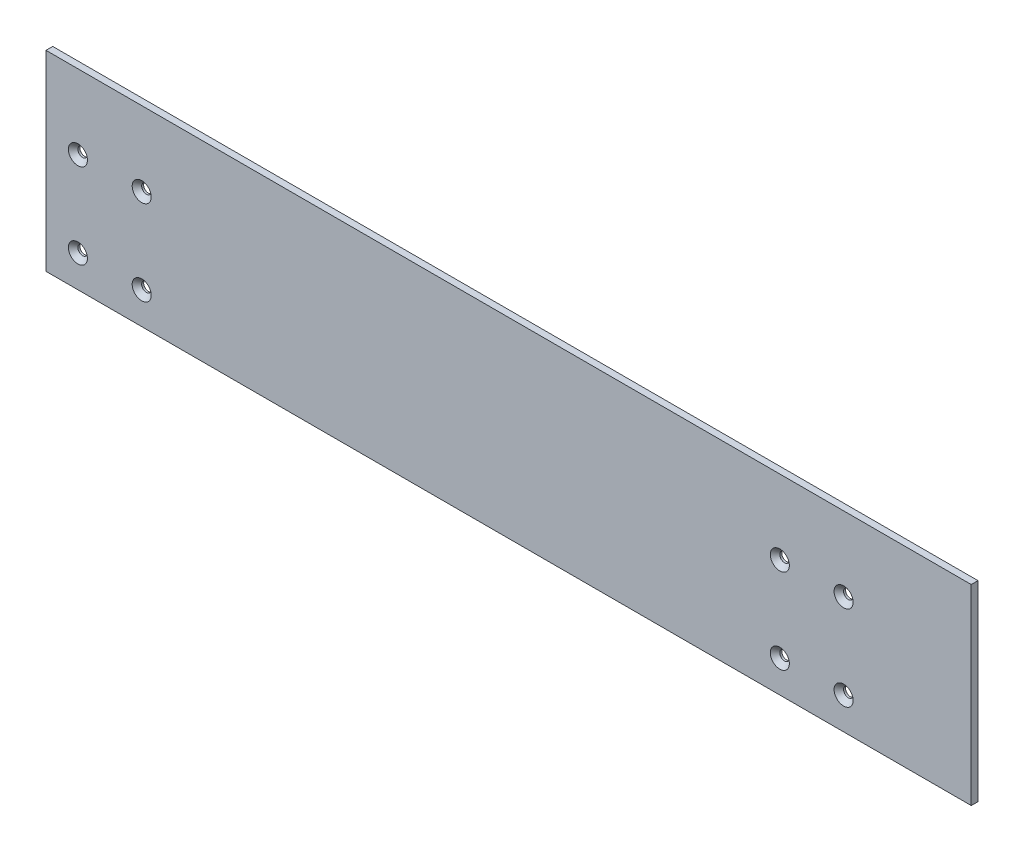
from build123d import *

# Parameters (mm, degrees)
SKETCH2_W                    = 435
SKETCH2_H                    = 90
BOSS_EXTRUDE1_DEPTH          = 3.175
CSK_FOR_M4_SFHCS1_AT_2_COUNT = 2
CSK_FOR_M4_SFHCS1_AT_2_PITCH = 50
CSK_FOR_M4_SFHCS1_AT_3_COUNT = 2
CSK_FOR_M4_SFHCS1_AT_3_PITCH = 30
CSK_FOR_M4_SFHCS1_AT_4_COUNT = 2
CSK_FOR_M4_SFHCS1_AT_4_PITCH = 40
CSK_FOR_M4_SFHCS1_AT_5_COUNT = 2
CSK_FOR_M4_SFHCS1_AT_5_PITCH = 330
CSK_FOR_M4_SFHCS1_AT_6_COUNT = 2
CSK_FOR_M4_SFHCS1_AT_6_PITCH = 302.654919008
CSK_FOR_M4_SFHCS1_AT_7_COUNT = 2
CSK_FOR_M4_SFHCS1_AT_7_PITCH = 300
CSK_FOR_M4_SFHCS1_AT_8_COUNT = 2
CSK_FOR_M4_SFHCS1_AT_8_PITCH = 332.415402772


with BuildPart() as part:
    # Sketch2 → Boss-Extrude1 (new body)
    with BuildSketch(Plane.XY):
        Rectangle(SKETCH2_W, SKETCH2_H)
    extrude(amount=BOSS_EXTRUDE1_DEPTH)

    # Sketch4 → CSK for M4 SFHCS1 (revolve, cut)
    with BuildSketch(Plane(origin=(-172.5, 10, 3.175), x_dir=(0, -1, 0), z_dir=(1, 0, 0))):
        Polygon((0, 0), (0, 3.175), (2.25, 3.175), (2.25, 2.23), (4.48, 0), align=None)
    csk_for_m4_sfhcs1 = revolve(axis=Axis((-172.5, 10, 9.525), (0, 0, -1)), mode=Mode.SUBTRACT)

    # CSK for M4 SFHCS1 at 2: CSK for M4 SFHCS1 ×2
    with Locations(*[Vector(-0.6, -0.8, 0) * (i * CSK_FOR_M4_SFHCS1_AT_2_PITCH) for i in range(1, CSK_FOR_M4_SFHCS1_AT_2_COUNT)]):
        add(csk_for_m4_sfhcs1, mode=Mode.SUBTRACT)

    # CSK for M4 SFHCS1 at 3: CSK for M4 SFHCS1 ×2
    with Locations(*[(-i * CSK_FOR_M4_SFHCS1_AT_3_PITCH, 0, 0) for i in range(1, CSK_FOR_M4_SFHCS1_AT_3_COUNT)]):
        add(csk_for_m4_sfhcs1, mode=Mode.SUBTRACT)

    # CSK for M4 SFHCS1 at 4: CSK for M4 SFHCS1 ×2
    with Locations(*[(0, -i * CSK_FOR_M4_SFHCS1_AT_4_PITCH, 0) for i in range(1, CSK_FOR_M4_SFHCS1_AT_4_COUNT)]):
        add(csk_for_m4_sfhcs1, mode=Mode.SUBTRACT)

    # CSK for M4 SFHCS1 at 5: CSK for M4 SFHCS1 ×2
    with Locations(*[(i * CSK_FOR_M4_SFHCS1_AT_5_PITCH, 0, 0) for i in range(1, CSK_FOR_M4_SFHCS1_AT_5_COUNT)]):
        add(csk_for_m4_sfhcs1, mode=Mode.SUBTRACT)

    # CSK for M4 SFHCS1 at 6: CSK for M4 SFHCS1 ×2
    with Locations(*[Vector(0.9912279006826347, -0.13216372009101798, 0) * (i * CSK_FOR_M4_SFHCS1_AT_6_PITCH) for i in range(1, CSK_FOR_M4_SFHCS1_AT_6_COUNT)]):
        add(csk_for_m4_sfhcs1, mode=Mode.SUBTRACT)

    # CSK for M4 SFHCS1 at 7: CSK for M4 SFHCS1 ×2
    with Locations(*[(i * CSK_FOR_M4_SFHCS1_AT_7_PITCH, 0, 0) for i in range(1, CSK_FOR_M4_SFHCS1_AT_7_COUNT)]):
        add(csk_for_m4_sfhcs1, mode=Mode.SUBTRACT)

    # CSK for M4 SFHCS1 at 8: CSK for M4 SFHCS1 ×2
    with Locations(*[Vector(0.9927337820337083, -0.12033136751923737, 0) * (i * CSK_FOR_M4_SFHCS1_AT_8_PITCH) for i in range(1, CSK_FOR_M4_SFHCS1_AT_8_COUNT)]):
        add(csk_for_m4_sfhcs1, mode=Mode.SUBTRACT)


solid = part.part
